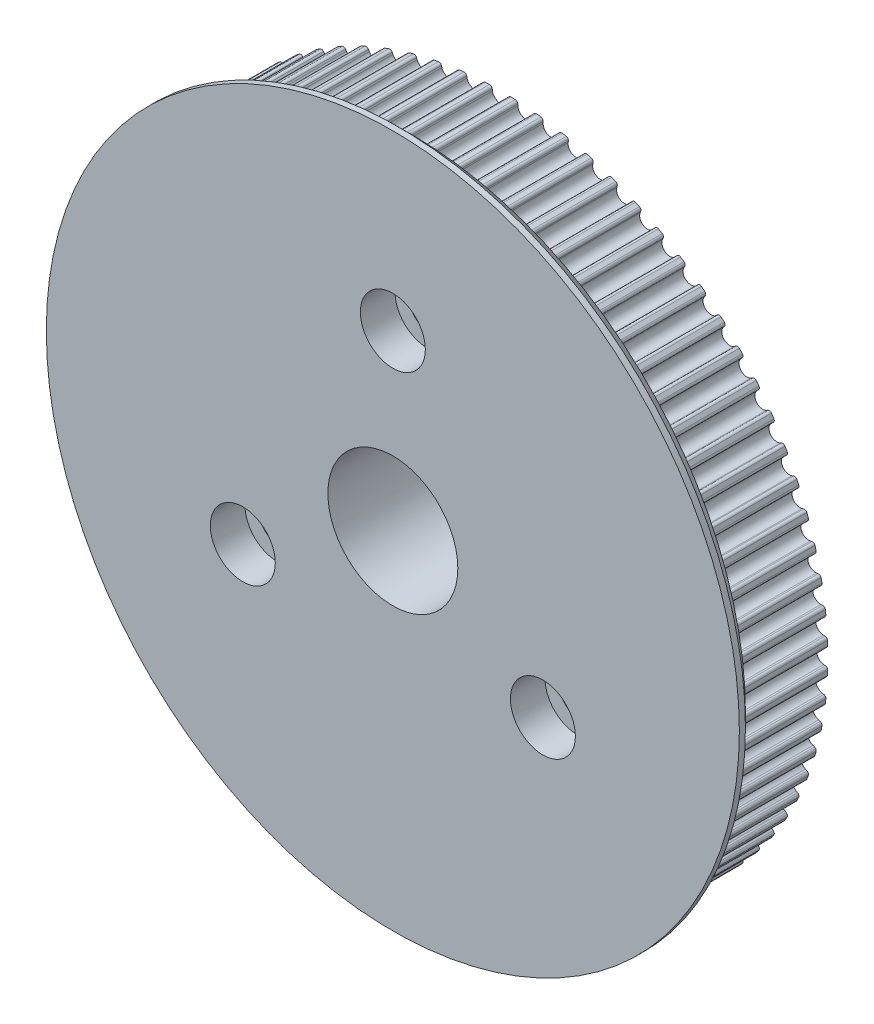
from build123d import *
from build123d.topology import SkipClean

# Parameters (mm, degrees)
SKETCH1_R           = 37.815
BOSS_EXTRUDE1_DEPTH = 10.2
CUT_EXTRUDE1_START  = -10.2
CUT_EXTRUDE1_DEPTH  = 10.2
CIRPATTERN1_COUNT   = 80
SKETCH4_R           = 40
BOSS_EXTRUDE2_DEPTH = 2.2
SKETCH5_R           = 7.5
CUT_EXTRUDE2_DEPTH  = 12.4
CHAMFER1_SIZE       = 1.5
SKETCH8_R           = 2
CUT_EXTRUDE6_DEPTH  = 12.4
SKETCH9_R           = 3.75
CUT_EXTRUDE5_DEPTH  = 4


with BuildPart() as part:
    # Sketch1 → Boss-Extrude1 (new body)
    with BuildSketch(Plane.XY):
        Circle(SKETCH1_R)
    extrude(amount=BOSS_EXTRUDE1_DEPTH)

    # Sketch3 → Cut-Extrude1 (cut)
    with SkipClean():  # the faces are left unmerged after this step: merging them gives an invalid solid
        with BuildSketch(Plane.XY.offset(10.2).offset(CUT_EXTRUDE1_START)):
            with BuildLine():
                Line((-0.927460675, 37.5315478), (-0.903216998, 37.334098898))
                ThreePointArc((-0.903216998, 37.334098898), (0, 36.535), (0.903216998, 37.334098898))
                Line((0.903216998, 37.334098898), (0.927460675, 37.5315478))
                ThreePointArc((0.927460675, 37.5315478), (1.030134596, 37.722890313), (1.235022397, 37.794826957))
                ThreePointArc((1.235022397, 37.794826957), (1.359823579, 37.790542532), (1.484609933, 37.785846005))
                Line((1.484609933, 37.785846005), (0, 42.815))
                Line((0, 42.815), (-1.484609933, 37.785846005))
                ThreePointArc((-1.484609933, 37.785846005), (-1.359823579, 37.790542532), (-1.235022397, 37.794826957))
                ThreePointArc((-1.235022397, 37.794826957), (-1.030134596, 37.722890313), (-0.927460675, 37.5315478))
            make_face()
        cut_extrude1 = extrude(amount=CUT_EXTRUDE1_DEPTH, mode=Mode.SUBTRACT)

    # CirPattern1: Cut-Extrude1 ×80 about axis
    with SkipClean():  # the faces are left unmerged after this step: merging them gives an invalid solid
        cirpattern1_axis = Axis((0, 0, 0), (0, 0, 1))
        for i in range(1, CIRPATTERN1_COUNT):
            add(cut_extrude1.rotate(cirpattern1_axis, i * 360 / CIRPATTERN1_COUNT), mode=Mode.SUBTRACT)

    # Sketch4 → Boss-Extrude2 (add)
    with SkipClean():  # the faces are left unmerged after this step: merging them gives an invalid solid
        with BuildSketch(Plane.XY.offset(10.2)):
            Circle(SKETCH4_R)
        extrude(amount=BOSS_EXTRUDE2_DEPTH)

    # Sketch5 → Cut-Extrude2 (cut)
    with SkipClean():  # the faces are left unmerged after this step: merging them gives an invalid solid
        with BuildSketch(Plane.XY.offset(12.4)):
            Circle(SKETCH5_R)
        extrude(amount=-CUT_EXTRUDE2_DEPTH, mode=Mode.SUBTRACT)

    # Chamfer1
    chamfer1_edges = [part.edges().sort_by_distance(p)[0] for p in [
        (-40, 0, 10.2),
    ]]
    chamfer(chamfer1_edges, length=CHAMFER1_SIZE)

    # Sketch8 → Cut-Extrude6 (cut)
    with SkipClean():  # the faces are left unmerged after this step: merging them gives an invalid solid
        with BuildSketch(Plane.XY.offset(12.4)):
            with Locations((0, 20)):
                Circle(SKETCH8_R)
            with Locations((17.320508076, -10)):
                Circle(SKETCH8_R)
            with Locations((-17.320508076, -10)):
                Circle(SKETCH8_R)
        extrude(amount=-CUT_EXTRUDE6_DEPTH, mode=Mode.SUBTRACT)

    # Sketch9 → Cut-Extrude5 (cut)
    with SkipClean():  # the faces are left unmerged after this step: merging them gives an invalid solid
        with BuildSketch(Plane.XY.offset(12.4)):
            with Locations((0, 20)):
                Circle(SKETCH9_R)
            with Locations((17.320508076, -10)):
                Circle(SKETCH9_R)
            with Locations((-17.320508076, -10)):
                Circle(SKETCH9_R)
        extrude(amount=-CUT_EXTRUDE5_DEPTH, mode=Mode.SUBTRACT)


solid = part.part
